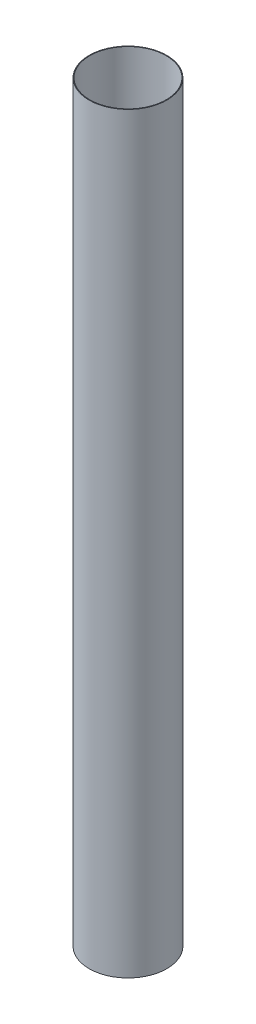
from build123d import *

# Parameters (mm, degrees)
SKETCH1_R           = 38.1
SKETCH1_R_2         = 37.465
BOSS_EXTRUDE1_DEPTH = 737.616


with BuildPart() as part:
    # Sketch1 → Boss-Extrude1 (new body)
    with BuildSketch(Plane(origin=(0, 0, 0), x_dir=(1, 0, 0), z_dir=(0, 1, 0))):
        Circle(SKETCH1_R)
        Circle(SKETCH1_R_2, mode=Mode.SUBTRACT)
    extrude(amount=BOSS_EXTRUDE1_DEPTH)


solid = part.part
